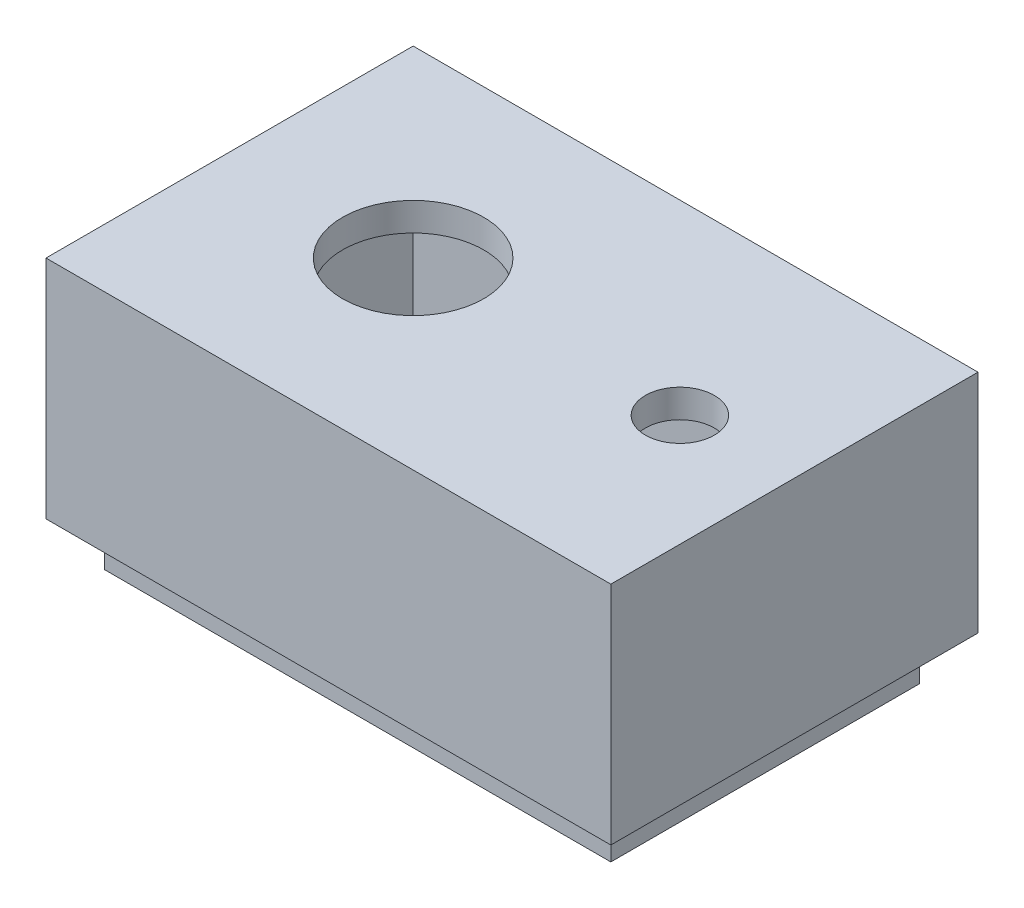
from build123d import *

# Parameters (mm, degrees)
STOCK_PART1_1_START         = 40
STOCK_PART1_1_OUTLINE_W     = 90
STOCK_PART1_1_OUTLINE_H     = 55
STOCK_PART1_1_DEPTH         = 40
STOCK_PART1_1_START_2       = 75
STOCK_PART1_1_2_OUTLINE_W   = 90
STOCK_PART1_1_2_OUTLINE_H   = 55
STOCK_PART1_1_2_OUTLINE_R   = 6.10322586
STOCK_PART1_1_2_OUTLINE_R_2 = 17.5
STOCK_PART1_1_2_DEPTH       = 5
SKETCH1_W                   = 5
SKETCH1_H                   = 8.27683309
SKETCH1_W_2                 = 4.100738493
SKETCH1_H_2                 = 4.176305195
SKETCH1_W_3                 = 4.702811088
SKETCH1_H_3                 = 4.424974218
SKETCH1_W_4                 = 6.384187924
SKETCH1_H_4                 = 4.971555085
BOSS_EXTRUDE2_DEPTH         = 40
SKETCH2_W                   = 90
SKETCH2_H                   = 55
SKETCH2_W_2                 = 87.6
SKETCH2_H_2                 = 52.6
EXTRUDE_THIN1_DEPTH         = 35
SKETCH3_W                   = 89.6
SKETCH3_H                   = 54.6
SKETCH3_W_2                 = 87.6
SKETCH3_H_2                 = 52.6
EXTRUDE_THIN2_DEPTH         = 35
SKETCH4_R                   = 23.5
SKETCH4_R_2                 = 12.5
EXTRUDE_THIN3_DEPTH         = 5
SKETCH5_W                   = 54.6
SKETCH5_H                   = 27.201852287
CUT_EXTRUDE1_DEPTH          = 115


# Read off the part's stored shape, not the designer's step: Stock-Part1-1
with BuildPart() as part:
    # Stock-Part1-1 outline → Stock-Part1-1 (new body)
    with BuildSketch(Plane(origin=(0, 0, 0), x_dir=(1, 0, 0), z_dir=(0, 1, 0)).offset(STOCK_PART1_1_START)):
        with BuildLine():
            Line((55.93220339, -29.999229584), (55.93220339, 31.000770416))
            ThreePointArc((55.93220339, 31.000770416), (52.517989827, 29.586556854), (53.93220339, 33.000770416))
            Line((53.93220339, 33.000770416), (-42.06779661, 33.000770416))
            ThreePointArc((-42.06779661, 33.000770416), (-40.653583048, 29.586556854), (-44.06779661, 31.000770416))
            Line((-44.06779661, 31.000770416), (-44.06779661, -29.999229584))
            ThreePointArc((-44.06779661, -29.999229584), (-40.653583048, -28.585016022), (-42.06779661, -31.999229584))
            Line((-42.06779661, -31.999229584), (53.93220339, -31.999229584))
            ThreePointArc((53.93220339, -31.999229584), (52.517989827, -28.585016021), (55.93220339, -29.999229584))
        make_face()
        with Locations((5.93220339, 0.500770416)):
            Rectangle(STOCK_PART1_1_OUTLINE_W, STOCK_PART1_1_OUTLINE_H, mode=Mode.SUBTRACT)
    extrude(amount=STOCK_PART1_1_DEPTH)

    # Stock-Part1-1 2 outline → Stock-Part1-1 2 (add)
    with BuildSketch(Plane(origin=(0, 0, 0), x_dir=(1, 0, 0), z_dir=(0, 1, 0)).offset(STOCK_PART1_1_START_2)):
        with Locations((5.93220339, 0.500770416)):
            Rectangle(STOCK_PART1_1_2_OUTLINE_W, STOCK_PART1_1_2_OUTLINE_H)
        with Locations((36.155377847, 0)):
            Circle(STOCK_PART1_1_2_OUTLINE_R, mode=Mode.SUBTRACT)
        with Locations((-11.56779661, 0.500770416)):
            Circle(STOCK_PART1_1_2_OUTLINE_R_2, mode=Mode.SUBTRACT)
    extrude(amount=STOCK_PART1_1_2_DEPTH)

    # Sketch1 → Boss-Extrude2 (add)
    with BuildSketch(Plane.XZ.offset(-40)):
        with Locations((-41.56779661, -28.862353871)):
            Rectangle(SKETCH1_W, SKETCH1_H)
        with Locations((53.881834144, -30.912617819)):
            Rectangle(SKETCH1_W_2, SKETCH1_H_2)
        with Locations((53.580797846, 29.786742475)):
            Rectangle(SKETCH1_W_3, SKETCH1_H_3)
        with Locations((-40.875702648, 29.513452042)):
            Rectangle(SKETCH1_W_4, SKETCH1_H_4)
    extrude(amount=-BOSS_EXTRUDE2_DEPTH)

    # Sketch2 → Extrude-Thin1 (add)
    with BuildSketch(Plane.XZ.offset(-75)):
        with Locations((5.93220339, -0.500770416)):
            Rectangle(SKETCH2_W, SKETCH2_H)
        with Locations((5.93220339, -0.500770416)):
            Rectangle(SKETCH2_W_2, SKETCH2_H_2, mode=Mode.SUBTRACT)
    extrude(amount=EXTRUDE_THIN1_DEPTH)

    # Sketch3 → Extrude-Thin2 (add)
    with BuildSketch(Plane.XZ.offset(-40)):
        with Locations((5.93220339, -0.500770416)):
            Rectangle(SKETCH3_W, SKETCH3_H)
        with Locations((5.93220339, -0.500770416)):
            Rectangle(SKETCH3_W_2, SKETCH3_H_2, mode=Mode.SUBTRACT)
    extrude(amount=EXTRUDE_THIN2_DEPTH)

    # Sketch4 → Extrude-Thin3 (add)
    with BuildSketch(Plane(origin=(0, 80, 0), x_dir=(1, 0, 0), z_dir=(0, 1, 0))):
        with Locations((-11.56779661, 0.500770416)):
            Circle(SKETCH4_R)
        with Locations((-11.56779661, 0.500770416)):
            Circle(SKETCH4_R_2, mode=Mode.SUBTRACT)
    extrude(amount=-EXTRUDE_THIN3_DEPTH)

    # Sketch5 → Cut-Extrude1 (cut)
    with BuildSketch(Plane.ZY.offset(38.86779661)):
        with Locations((-0.500770416, 18.600926144)):
            Rectangle(SKETCH5_W, SKETCH5_H)
    extrude(amount=-CUT_EXTRUDE1_DEPTH, mode=Mode.SUBTRACT)


solid = part.part
